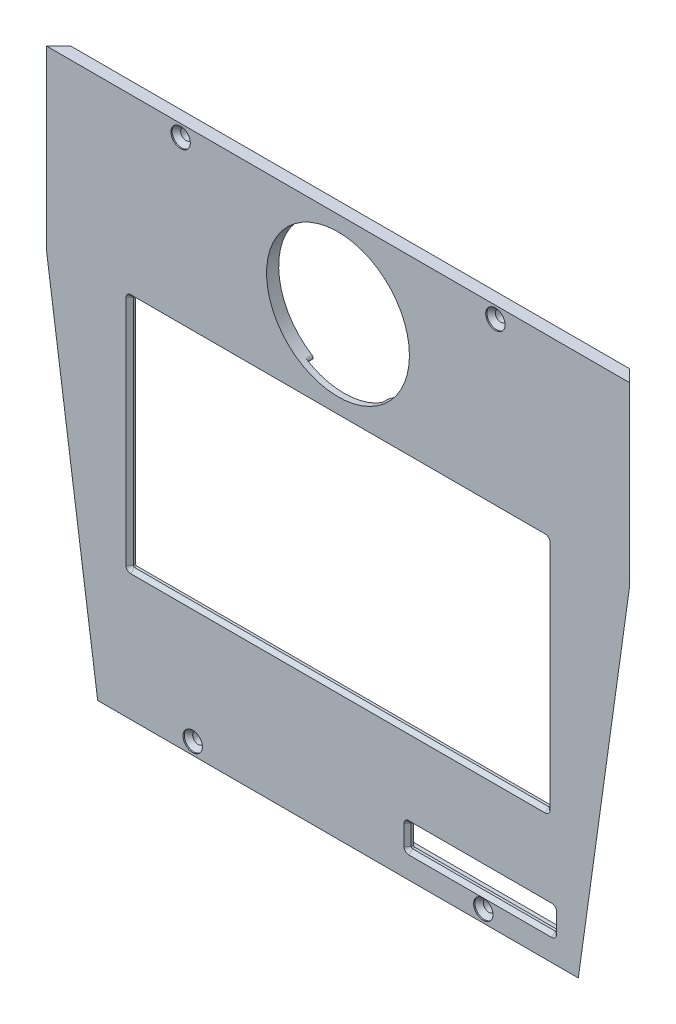
from build123d import *

# Parameters (mm, degrees)
SKETCH1_R                                    = 40
SKETCH1_W                                    = 120
SKETCH1_H                                    = 18.5
SKETCH1_W_2                                  = 344.2
SKETCH1_H_2                                  = 193.6
BOSS_EXTRUDE1_DEPTH                          = 5
CUT_EXTRUDE1_DEPTH                           = 5
SKETCH3_R                                    = 59
CUT_EXTRUDE2_DEPTH                           = 491.321307177
FILLET1_R                                    = 1
FILLET2_R                                    = 2
CHAMFER1_SIZE                                = 3
CHAMFER2_SIZE                                = 10
CSK_FOR_M8_HEX_SOCKET_COUNTERSUNK_HE_2_COUNT = 2
CSK_FOR_M8_HEX_SOCKET_COUNTERSUNK_HE_2_PITCH = 260
CSK_FOR_M8_HEX_SOCKET_COUNTERSUNK_HE_3_COUNT = 2
CSK_FOR_M8_HEX_SOCKET_COUNTERSUNK_HE_3_PITCH = 494.801980594
CSK_FOR_M8_HEX_SOCKET_COUNTERSUNK_HE_4_COUNT = 2
CSK_FOR_M8_HEX_SOCKET_COUNTERSUNK_HE_4_PITCH = 427.117079968
FILLET3_R                                    = 5


with BuildPart() as part:
    # Sketch1 → Boss-Extrude1 (new, symmetric)
    with BuildSketch(Plane.XY.offset(5)):
        Polygon((-198.5, -20), (198.5, -20), (240.802791245, 281), (240.802791245, 427), (-240.802791245, 427), (-240.802791245, 281), align=None)
        with Locations((0, 355.5)):
            Circle(SKETCH1_R, mode=Mode.SUBTRACT)
        with Locations((117.5, 10.25)):
            Rectangle(SKETCH1_W, SKETCH1_H, mode=Mode.SUBTRACT)
        with Locations((0, 184.15)):
            Rectangle(SKETCH1_W_2, SKETCH1_H_2, mode=Mode.SUBTRACT)
    extrude(amount=BOSS_EXTRUDE1_DEPTH, both=True)

    # Sketch2 → Cut-Extrude1 (cut)
    with BuildSketch(Plane(origin=(0, 0, 0), x_dir=(-1, 0, 0), z_dir=(0, 0, -1))):
        with BuildLine():
            Line((196, 34.064541037), (196, 68.5))
            Line((196, 68.5), (196, 297))
            ThreePointArc((196, 297), (194.535533906, 300.535533906), (191, 302))
            Line((191, 302), (-191, 302))
            ThreePointArc((-191, 302), (-194.535533906, 300.535533906), (-196, 297))
            Line((-196, 297), (-196, 68.5))
            Line((-196, 68.5), (-196, 34.064541037))
            Line((-196, 34.064541037), (-191.072000134, -1))
            Line((-191.072000134, -1), (191.072000134, -1))
            Line((191.072000134, -1), (196, 34.064541037))
        make_face()
    extrude(amount=-CUT_EXTRUDE1_DEPTH, mode=Mode.SUBTRACT)

    # Sketch3 → Cut-Extrude2 (cut, through all)
    with BuildSketch(Plane.XY.offset(10)):
        with Locations((0, 355.5)):
            Circle(SKETCH3_R)
    extrude(amount=-CUT_EXTRUDE2_DEPTH, mode=Mode.SUBTRACT)

    # Fillet1
    fillet1_edges = [part.edges().sort_by_distance(p)[0] for p in [
        (177.5, 1, 7.5),
        (177.5, 19.5, 7.5),
        (57.5, 19.5, 7.5),
        (57.5, 1, 7.5),
        (-172.1, 280.95, 7.5),
        (-172.1, 87.35, 7.5),
        (172.1, 87.35, 7.5),
        (172.1, 280.95, 7.5),
    ]]
    fillet(fillet1_edges, radius=FILLET1_R)

    # Fillet2
    fillet2_edges = [part.edges().sort_by_distance(p)[0] for p in [
        (-24.874685928, 302, 2.5),
        (24.874685928, 302, 2.5),
    ]]
    fillet(fillet2_edges, radius=FILLET2_R)

    # Chamfer1
    chamfer1_edges = [part.edges().sort_by_distance(p)[0] for p in [
        (57.5, 10.25, 10),
        (117.5, 1, 10),
        (117.5, 19.5, 10),
        (177.5, 10.25, 10),
        (0, 87.35, 10),
        (172.1, 184.15, 10),
        (0, 280.95, 10),
        (-172.1, 184.15, 10),
        (57.792893219, 1.292893219, 10),
        (57.792893219, 19.207106781, 10),
        (177.207106781, 19.207106781, 10),
        (177.207106781, 1.292893219, 10),
        (171.807106781, 87.642893219, 10),
        (171.807106781, 280.657106781, 10),
        (-171.807106781, 280.657106781, 10),
        (-171.807106781, 87.642893219, 10),
    ]]
    chamfer(chamfer1_edges, length=CHAMFER1_SIZE)

    # Chamfer2
    chamfer2_edges = [part.edges().sort_by_distance(p)[0] for p in [
        (219.651395623, 130.5, 0),
        (240.802791245, 354, 0),
        (-219.651395623, 130.5, 0),
        (-240.802791245, 354, 0),
    ]]
    chamfer(chamfer2_edges, length=CHAMFER2_SIZE - 0.0001)  # a hair under: the kernel refuses the full size

    # Sketch5 → CSK for M8 Hex Socket Countersunk Head Screw1 (revolve, cut)
    with BuildSketch(Plane(origin=(-130, 417, 10), x_dir=(0, -1, 0), z_dir=(1, 0, 0))):
        Polygon((0, 0), (0, 10), (4.5, 10), (4.5, 4.5), (8, 1), (8, 0), align=None)
    csk_for_m8_hex_socket_countersunk_head_s = revolve(axis=Axis((-130, 417, 16.35), (0, 0, -1)), mode=Mode.SUBTRACT)

    # CSK for M8 Hex Socket Countersunk He 2: CSK for M8 Hex Socket Countersunk Head Screw1 ×2
    with Locations(*[(i * CSK_FOR_M8_HEX_SOCKET_COUNTERSUNK_HE_2_PITCH, 0, 0) for i in range(1, CSK_FOR_M8_HEX_SOCKET_COUNTERSUNK_HE_2_COUNT)]):
        add(csk_for_m8_hex_socket_countersunk_head_s, mode=Mode.SUBTRACT)

    # CSK for M8 Hex Socket Countersunk He 3: CSK for M8 Hex Socket Countersunk Head Screw1 ×2
    with Locations(*[Vector(0.5052526259085499, -0.8629714850518034, 0) * (i * CSK_FOR_M8_HEX_SOCKET_COUNTERSUNK_HE_3_PITCH) for i in range(1, CSK_FOR_M8_HEX_SOCKET_COUNTERSUNK_HE_3_COUNT)]):
        add(csk_for_m8_hex_socket_countersunk_head_s, mode=Mode.SUBTRACT)

    # CSK for M8 Hex Socket Countersunk He 4: CSK for M8 Hex Socket Countersunk Head Screw1 ×2
    with Locations(*[Vector(0.02341278414986336, -0.9997258831991657, 0) * (i * CSK_FOR_M8_HEX_SOCKET_COUNTERSUNK_HE_4_PITCH) for i in range(1, CSK_FOR_M8_HEX_SOCKET_COUNTERSUNK_HE_4_COUNT)]):
        add(csk_for_m8_hex_socket_countersunk_head_s, mode=Mode.SUBTRACT)

    # Fillet3
    fillet3_edges = [part.edges().sort_by_distance(p)[0] for p in [
        (-196, 34.064541037, 2.5),
        (-191.072000134, -1, 2.5),
        (191.072000134, -1, 2.5),
        (196, 34.064541037, 2.5),
    ]]
    fillet(fillet3_edges, radius=FILLET3_R)


solid = part.part
